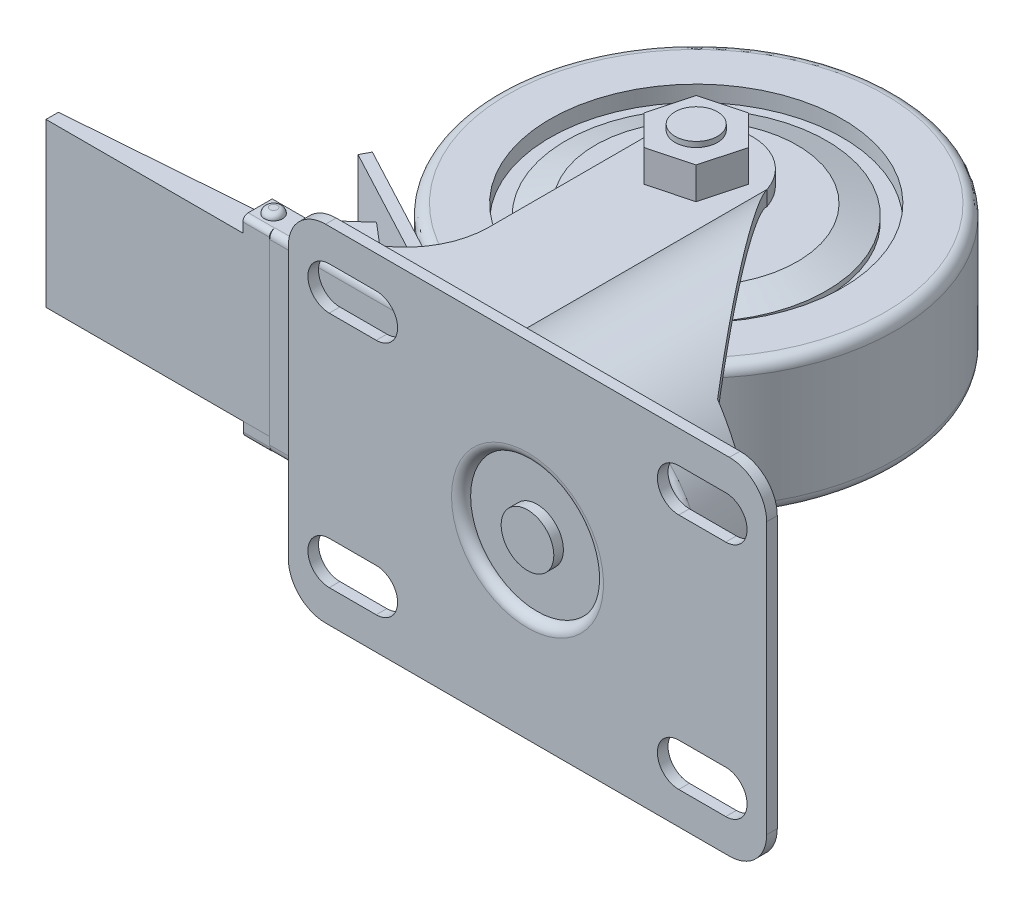
from build123d import *

# Parameters (mm, degrees)
CUT_EXTRUDE_2_DEPTH      = 85.445062578
CUT_EXTRUDE_2_DEPTH_BACK = 85.445062578
CUT_EXTRUDE_3_DEPTH      = 85.445062578
CUT_EXTRUDE_3_DEPTH_BACK = 85.445062578
EXTRUDE_6_DEPTH          = 40
EXTRUDE_7_DEPTH          = 2.8
CUT_EXTRUDE_4_DEPTH      = 103.254861861
SKETCH_18_R              = 4
EXTRUDE_8_DEPTH          = 0.3
EXTRUDE_9_DEPTH          = 6
SKETCH_20_R              = 4
EXTRUDE_10_DEPTH         = 1
EXTRUDE_START            = 0.3
SKETCH_21_R              = 4
EXTRUDE_11_DEPTH         = 0.3
SKETCH_22_R              = 5.5
EXTRUDE_12_DEPTH         = 1
FILLET_1_R               = 1
EXTRUDE_13_DEPTH         = 12.5
EXTRUDE_13_DEPTH_BACK    = 12.5
SKETCH_23_R              = 37.5
FILLET_2_R               = 2
SKETCH_24_R              = 27.5
SKETCH_24_R_2            = 24.5
CUT_EXTRUDE_5_DEPTH      = 3
CHAMFER_1_SIZE           = 2
CHAMFER_1_SIZE2          = 5.494954839
CHAMFER_2_SIZE           = 6.5
CHAMFER_2_SIZE2          = 2.365806523
SKETCH_25_R              = 6
EXTRUDE_14_DEPTH         = 3
SKETCH_28_W              = 5.514229373
SKETCH_28_H              = 2.811946084
SKETCH_28_W_2            = 5.444280039
EXTRUDE_15_DEPTH         = 5
FILLET_3_R               = 1
EXTRUDE_16_DEPTH         = 30.638170479
SKETCH_30_R              = 1.704211516
EXTRUDE_17_DEPTH         = 1
FILLET_4_R               = 1
FILLET_4_OF_MIRROR_7_R   = 1
EXTRUDE_18_DEPTH         = 30.638170479
EXTRUDE_21_DEPTH         = 10
EXTRUDE_21_DEPTH_BACK    = 10
SKETCH_33_W              = 90
SKETCH_33_H              = 65
EXTRUDE_22_DEPTH         = 2
FILLET_5_R               = 7
CUT_EXTRUDE_6_DEPTH      = 2
MIRROR_9_COPY_1_DEPTH    = 2
SKETCH_35_R              = 12.5
SKETCH_35_R_2            = 4.952549827
CUT_EXTRUDE_8_DEPTH      = 1.8
FILLET_6_R               = 1.8


# Read off the part's stored shape, not the designer's step: 加厚3
# Some blends are built 0.0001 mm under size
with BuildPart() as part:
    # 加厚3 outline → 加厚3 (revolve)
    with BuildSketch(Plane.XZ):
        with BuildLine():
            Line((22.51498107, -15), (22.51498107, -77))
            Line((22.51498107, -77), (24.51498107, -77))
            Line((24.51498107, -77), (24.51498107, -14))
            ThreePointArc((24.51498107, -14), (24.222087851, -13.292893219), (23.51498107, -13))
            Line((23.51498107, -13), (7.588114325, -13))
            Line((7.588114325, -13), (7.588114325, -15))
            Line((7.588114325, -15), (22.51498107, -15))
        make_face()
    revolve(axis=Axis((0, 0, 0), (0, 0, 1)))

    # 草图13 → 切除-拉伸2 (cut, two sides: drawn at the far end of the back side and taken through both)
    with BuildSketch(Plane(origin=(0, 0, 0), x_dir=(1, 0, 0), z_dir=(0, 1, 0)).offset(-CUT_EXTRUDE_2_DEPTH_BACK)):
        Polygon((-24.51498107, 77), (14.604928022, 26.16151052), (24.51498107, 23.088616514), (24.51498107, 77), align=None)
    extrude(amount=CUT_EXTRUDE_2_DEPTH + CUT_EXTRUDE_2_DEPTH_BACK, mode=Mode.SUBTRACT)

    # 草图14 → 切除-拉伸3 (cut, two sides: drawn at the far end of the back side and taken through both)
    with BuildSketch(Plane(origin=(0, 0, 0), x_dir=(1, 0, 0), z_dir=(0, 1, 0)).offset(-CUT_EXTRUDE_3_DEPTH_BACK)):
        Polygon((-16.5, 70.472511213), (-16.5, 12.57524565), (-25.363625659, 12.57524565), (-25.363625659, 79.702348144), align=None)
    extrude(amount=CUT_EXTRUDE_3_DEPTH + CUT_EXTRUDE_3_DEPTH_BACK, mode=Mode.SUBTRACT)

    # 草图15 → 凸台-拉伸6 (add)
    with BuildSketch(Plane.ZY.offset(16.5)):
        with BuildLine():
            Line((-13, -16.754233337), (-13, 16.754233337))
            add(Edge.make_bspline(
                [(-13, 16.754233337), (-13, 17.066282989), (-13.071981627, 17.383432621), (-13.278379206, 17.716834739), (-13.32508278, 17.779332115), (-13.431437184, 17.894341909), (-13.491489359, 17.946901419), (-13.686888914, 18.078052515), (-13.843794025, 18.131031324), (-14, 18.131031324)],
                knots=[0, 0, 0, 0, 0.5, 0.5, 0.625, 0.625, 0.75, 0.75, 1, 1, 1, 1], degree=3))
            Line((-14, 18.131031324), (-66.584087994, 18.131031324))
            Line((-66.584087994, 18.131031324), (-66.584087994, 15.31908524))
            Line((-66.584087994, 15.31908524), (-15, 15.31908524))
            Line((-15, 15.31908524), (-15, -15.31908524))
            Line((-15, -15.31908524), (-66.584087994, -15.31908524))
            Line((-66.584087994, -15.31908524), (-66.584087994, -18.131031324))
            Line((-66.584087994, -18.131031324), (-14, -18.131031324))
            add(Edge.make_bspline(
                [(-14, -18.131031324), (-13.842407053, -18.131031324), (-13.686831177, -18.07799673), (-13.491621762, -17.946998796), (-13.431468043, -17.894358188), (-13.325276406, -17.779558555), (-13.278292746, -17.716769524), (-13.153663134, -17.515226129), (-13.095772202, -17.370480096), (-13.018069892, -17.065294363), (-13, -16.910169012), (-13, -16.754233337)],
                knots=[0, 0, 0, 0, 0.25, 0.25, 0.375, 0.375, 0.5, 0.5, 0.75, 0.75, 1, 1, 1, 1], degree=3))
        make_face()
    extrude(amount=EXTRUDE_6_DEPTH)

    # 草图16 → 凸台-拉伸7 (add)
    with BuildSketch(Plane(origin=(0, 18.131031324, 0), x_dir=(1, 0, 0), z_dir=(0, 1, 0))):
        with BuildLine():
            Line((-16.5, 66.584087994), (-36.5, 66.584087994))
            ThreePointArc((-36.5, 66.584087994), (-26.5, 73.791086056), (-16.5, 66.584087994))
        make_face()
    extrude_7 = extrude(amount=-EXTRUDE_7_DEPTH)

    # 镜向1: 凸台-拉伸7 across plane
    add(extrude_7.mirror(Plane.ZX))

    # 草图17 → 切除-拉伸4 (cut, through all)
    with BuildSketch(Plane(origin=(0, 18.131031324, 0), x_dir=(1, 0, 0), z_dir=(0, 1, 0))):
        with BuildLine():
            Line((-36.5, 66.584087994), (-36.5, 34.244911042))
            ThreePointArc((-36.5, 34.244911042), (-41.122054778, 23.08628371), (-52.28068211, 18.464228931))
            Line((-52.28068211, 18.464228931), (-56.5, 18.464228931))
            Line((-56.5, 18.464228931), (-56.5, 66.584087994))
            Line((-56.5, 66.584087994), (-36.5, 66.584087994))
        make_face()
    extrude(amount=-CUT_EXTRUDE_4_DEPTH, mode=Mode.SUBTRACT)

    # 草图18 → 凸台-拉伸8 (add)
    with BuildSketch(Plane(origin=(0, 18.131031324, 0), x_dir=(1, 0, 0), z_dir=(0, 1, 0))):
        with Locations(Location((-26.5, 63.249885701, 0), (0, 0, 90))):
            Circle(SKETCH_18_R)
    extrude(amount=EXTRUDE_8_DEPTH)

    # 草图19 → 凸台-拉伸9 (add)
    with BuildSketch(Plane(origin=(0, 18.431031324, 0), x_dir=(1, 0, 0), z_dir=(0, 1, 0))):
        Polygon((-20.84640115, 57.589777924), (-18.771403452, 65.31599204), (-24.425002303, 70.976099816), (-32.15359885, 68.909993477), (-34.228596548, 61.183779361), (-28.574997697, 55.523671585), align=None)
    extrude(amount=EXTRUDE_9_DEPTH)

    # 草图20 → 凸台-拉伸10 (add)
    with BuildSketch(Plane(origin=(0, 24.431031324, 0), x_dir=(1, 0, 0), z_dir=(0, 1, 0))):
        with Locations(Location((-26.5, 63.249885701, 0), (0, 0, 90))):
            Circle(SKETCH_20_R)
    extrude(amount=EXTRUDE_10_DEPTH)

    # 草图21 → 凸台-拉伸11 (add)
    with BuildSketch(Plane.XZ.offset(18.131031324).offset(EXTRUDE_START)):
        with Locations(Location((-26.5, -63.249885701, 0), (0, 0, 270))):
            Circle(SKETCH_21_R)
    extrude(amount=-EXTRUDE_11_DEPTH)

    # 草图22 → 凸台-拉伸12 (add)
    with BuildSketch(Plane.XZ.offset(18.431031324)):
        with Locations(Location((-26.5, -63.249885701, 0), (0, 0, 270))):
            Circle(SKETCH_22_R)
    extrude(amount=EXTRUDE_12_DEPTH)

    # 圆角1
    fillet_1_edges = [part.edges().sort_by_distance(p)[0] for p in [
        (-26.5, -19.431031324, -57.749885701),
    ]]
    fillet(fillet_1_edges, radius=FILLET_1_R - 0.0001)  # a hair under: the kernel refuses the full size



with BuildPart() as body_2:
    # 草图23 → 凸台-拉伸13 (new, two sides: drawn at the far end of the back side and taken through both)
    with BuildSketch(Plane(origin=(0, 0, 0), x_dir=(1, 0, 0), z_dir=(0, 1, 0)).offset(-EXTRUDE_13_DEPTH_BACK)):
        with Locations(Location((-26.5, 63.249885701, 0), (0, 0, 270))):
            Circle(SKETCH_23_R)
    extrude(amount=EXTRUDE_13_DEPTH + EXTRUDE_13_DEPTH_BACK)

    # 圆角2
    fillet_2_edges = [body_2.edges().sort_by_distance(p)[0] for p in [
        (-26.5, -12.5, -100.749885701),
        (-26.5, 12.5, -100.749885701),
    ]]
    fillet(fillet_2_edges, radius=FILLET_2_R)

    # 草图24 → 切除-拉伸5 (cut)
    with BuildSketch(Plane(origin=(0, 12.5, 0), x_dir=(1, 0, 0), z_dir=(0, 1, 0))):
        with Locations(Location((-26.5, 63.249885701, 0), (0, 0, 270))):
            Circle(SKETCH_24_R)
        with Locations(Location((-26.5, 63.249885701, 0), (0, 0, 270))):
            Circle(SKETCH_24_R_2, mode=Mode.SUBTRACT)
    cut_extrude_5 = extrude(amount=-CUT_EXTRUDE_5_DEPTH, mode=Mode.SUBTRACT)

    # 镜向2: 切除-拉伸5 across plane
    add(cut_extrude_5.mirror(Plane.ZX), mode=Mode.SUBTRACT)

    # 倒角1
    chamfer_1_edges = [body_2.edges().sort_by_distance(p)[0] for p in [
        (-26.5, 12.5, -87.749885701),
    ]]
    chamfer_1_side = [body_2.faces().sort_by_distance(p)[0] for p in [
        (-26.5, 11, -87.749885701),
    ]]
    chamfer(chamfer_1_edges, length=CHAMFER_1_SIZE, length2=CHAMFER_1_SIZE2, reference=chamfer_1_side[0])

    # 倒角2
    chamfer_2_edges = [body_2.edges().sort_by_distance(p)[0] for p in [
        (-26.5, -12.5, -87.749885701),
    ]]
    chamfer_2_side = [body_2.faces().sort_by_distance(p)[0] for p in [
        (-26.5, -12.5, -63.249885701),
    ]]
    chamfer(chamfer_2_edges, length=CHAMFER_2_SIZE, length2=CHAMFER_2_SIZE2, reference=chamfer_2_side[0])


with BuildPart() as part_1:
    add(part.part)

    add(body_2.part)  # 凸台-拉伸14 merges body 2
    # 草图25 → 凸台-拉伸14 (add)
    with BuildSketch(Plane(origin=(0, 12.5, 0), x_dir=(1, 0, 0), z_dir=(0, 1, 0))):
        with Locations(Location((-26.5, 63.249885701, 0), (0, 0, 33.758968922))):
            Circle(SKETCH_25_R)
    extrude_14 = extrude(amount=EXTRUDE_14_DEPTH)

    # 镜向5: 凸台-拉伸14 across plane
    add(extrude_14.mirror(Plane.ZX))

    # 草图28 → 凸台-拉伸15 (add)
    with BuildSketch(Plane.ZY.offset(56.5)):
        with Locations((-15.707114245, 16.725058282)):
            Rectangle(SKETCH_28_W, SKETCH_28_H)
        with Locations((-15.742088912, -16.725058282)):
            Rectangle(SKETCH_28_W_2, SKETCH_28_H)
    extrude(amount=EXTRUDE_15_DEPTH)

    # 圆角3
    # the kernel refuses this fillet: 1 mm, written as the material it takes off along each edge
    with BuildSketch(Plane(origin=(-54, -18.131031324, -13.019948892), x_dir=(0, 1, 0), z_dir=(-1, 0, 0))) as fillet_3_piece_1:
        with BuildLine():
            CenterArc((FILLET_3_R, FILLET_3_R), FILLET_3_R, 180, 90)
            Line((0, FILLET_3_R), (0, 0))
            Line((0, 0), (FILLET_3_R, 0))
        make_face()
    extrude(amount=10, mode=Mode.SUBTRACT)
    with BuildSketch(Plane(origin=(-54, 18.131031324, -12.949999558), x_dir=(0, -1, 0), z_dir=(-1, 0, 0))) as fillet_3_piece_2:
        with BuildLine():
            CenterArc((FILLET_3_R, -FILLET_3_R), FILLET_3_R, 90, 90)
            Line((0, -FILLET_3_R), (0, 0))
            Line((0, 0), (FILLET_3_R, 0))
        make_face()
    extrude(amount=10, mode=Mode.SUBTRACT)

    # 草图29 → 凸台-拉伸16 (add)
    with BuildSketch(Plane(origin=(0, -15.31908524, 0), x_dir=(1, 0, 0), z_dir=(0, 1, 0))):
        Polygon((-56.5, 12.949999558), (-98.547782496, 12.949999558), (-98.547782496, 15.287980311), (-56.890341055, 18.464228931), align=None)
    extrude(amount=EXTRUDE_16_DEPTH)

    # 草图30 → 凸台-拉伸17 (add)
    with BuildSketch(Plane(origin=(0, 18.131031324, 0), x_dir=(1, 0, 0), z_dir=(0, 1, 0))):
        with Locations(Location((-58.978440112, 16.207114245, 0), (0, 0, 90))):
            Circle(SKETCH_30_R)
    extrude_17 = extrude(amount=EXTRUDE_17_DEPTH)

    # 圆角4
    fillet_4_edges = [part_1.edges().sort_by_distance(p)[0] for p in [
        (-58.978440112, 19.131031324, -14.502902728),
    ]]
    fillet(fillet_4_edges, radius=FILLET_4_R - 0.0001)  # a hair under: the kernel refuses the full size

    # 镜向7: 凸台-拉伸17 across plane
    add(extrude_17.mirror(Plane.ZX))

    # 圆角4 of 镜向7
    fillet_4_of_mirror_7_edges = [part_1.edges().sort_by_distance(p)[0] for p in [
        (-58.978440112, -19.131031324, -14.502902728),
    ]]
    fillet(fillet_4_of_mirror_7_edges, radius=FILLET_4_OF_MIRROR_7_R - 0.0001)  # a hair under: the kernel refuses the full size

    # 草图31 → 凸台-拉伸18 (add)
    with BuildSketch(Plane(origin=(0, -15.31908524, 0), x_dir=(1, 0, 0), z_dir=(0, 1, 0))):
        Polygon((-27.595064563, 19.751491867), (-62.524058105, 38.335507661), (-63.463471751, 36.569862736), (-28.53447821, 17.985846941), align=None)
    extrude(amount=EXTRUDE_18_DEPTH)


with BuildPart() as body_2_2:
    # 草图32 → 凸台-拉伸21 (new, two sides: drawn at the far end of the back side and taken through both)
    with BuildSketch(Plane(origin=(0, 0, 0), x_dir=(1, 0, 0), z_dir=(0, 1, 0)).offset(-EXTRUDE_21_DEPTH_BACK)):
        Polygon((-73.310994796, 17.212205836), (-56.005318264, 32.601742611), (-42.990909795, 21.488341825), align=None)
    extrude(amount=EXTRUDE_21_DEPTH + EXTRUDE_21_DEPTH_BACK)


with BuildPart() as body_3:
    # 草图33 → 凸台-拉伸22 (new body)
    with BuildSketch(Plane.XY.offset(-7)):
        Rectangle(SKETCH_33_W, SKETCH_33_H)
    extrude(amount=EXTRUDE_22_DEPTH)

    # 圆角5
    fillet_5_edges = [body_3.edges().sort_by_distance(p)[0] for p in [
        (45, -32.5, -6),
        (-45, -32.5, -6),
        (-45, 32.5, -6),
        (45, 32.5, -6),
    ]]
    fillet(fillet_5_edges, radius=FILLET_5_R)

    # 草图34 → 切除-拉伸6 (cut)
    with BuildSketch(Plane.XY.offset(-5)):
        with BuildLine():
            Line((-37.302288021, 26.384280733), (-28.461004649, 26.384280733))
            ThreePointArc((-28.461004649, 26.384280733), (-24.44223948, 22.365515564), (-28.461004649, 18.346750395))
            Line((-28.461004649, 18.346750395), (-37.302288021, 18.346750395))
            ThreePointArc((-37.302288021, 18.346750395), (-41.32105319, 22.365515564), (-37.302288021, 26.384280733))
        make_face()
    cut_extrude_6 = extrude(amount=-CUT_EXTRUDE_6_DEPTH, mode=Mode.SUBTRACT)

    # 镜向8: 切除-拉伸6 across plane
    add(cut_extrude_6.mirror(Plane.ZX), mode=Mode.SUBTRACT)

    # 镜向9: 切除-拉伸6 across plane
    add(cut_extrude_6.mirror(Plane(origin=(0, 0, 0), x_dir=(0, 0, 1), z_dir=(1, 0, 0))), mode=Mode.SUBTRACT)

    # 镜向9 copy 1 sketch → 镜向9 copy 1 (cut)
    with BuildSketch(Plane(origin=(0, 0, -5), x_dir=(-1, 0, 0), z_dir=(0, 0, 1))):
        with BuildLine():
            Line((-37.302288021, 26.384280733), (-28.461004649, 26.384280733))
            ThreePointArc((-28.461004649, 26.384280733), (-24.44223948, 22.365515564), (-28.461004649, 18.346750395))
            Line((-28.461004649, 18.346750395), (-37.302288021, 18.346750395))
            ThreePointArc((-37.302288021, 18.346750395), (-41.32105319, 22.365515564), (-37.302288021, 26.384280733))
        make_face()
    extrude(amount=-MIRROR_9_COPY_1_DEPTH, mode=Mode.SUBTRACT)

    # 草图35 → 切除-拉伸8 (cut)
    with BuildSketch(Plane.XY.offset(-5)):
        Circle(SKETCH_35_R)
        Circle(SKETCH_35_R_2, mode=Mode.SUBTRACT)
    extrude(amount=-CUT_EXTRUDE_8_DEPTH, mode=Mode.SUBTRACT)

    # 圆角6
    fillet_6_edges = [body_3.edges().sort_by_distance(p)[0] for p in [
        (-12.5, 0, -5),
    ]]
    fillet(fillet_6_edges, radius=FILLET_6_R - 0.0001)  # a hair under: the kernel refuses the full size


solid = Compound([part_1.part, body_2_2.part, body_3.part])
